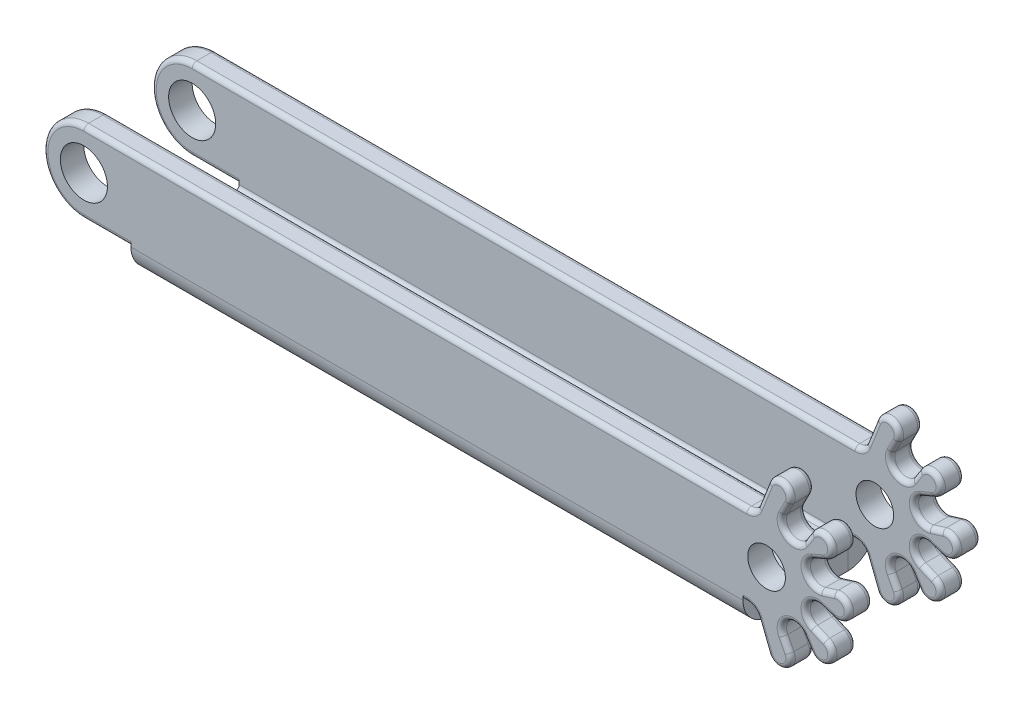
from build123d import *

# Parameters (mm, degrees)
SKETCH1_W                      = 130
SKETCH1_H                      = 28
BASE_FLANGE1_DEPTH             = 5
EDGE_FLANGE1_STRIP_W           = 21.4732
EDGE_FLANGE1_STRIP_H           = 5
EDGE_FLANGE1_STRIP_CUT_DEPTH   = 130
EDGE_FLANGE1_STRIP_2_W         = 21.4732
EDGE_FLANGE1_STRIP_2_H         = 5
EDGE_FLANGE1_STRIP_CUT_2_DEPTH = 130
EDGE_FLANGE1_DEPTH             = 130
EDGE_FLANGE1_BEND_DEPTH        = 130
SKETCH15_R                     = 5
BOSS_EXTRUDE1_DEPTH            = 5
BOSS_EXTRUDE2_DEPTH            = 5
SKETCH17_R                     = 4
CUT_EXTRUDE2_DEPTH             = 5
FILLET3_R                      = 2.5
FILLET4_R                      = 1


# Sheet-metal steps are written as plain solids
with BuildPart() as part:
    # Sketch1 → Base-Flange1 (new body)
    with BuildSketch(Plane(origin=(0, 0, 0), x_dir=(1, 0, 0), z_dir=(0, 1, 0))):
        Rectangle(SKETCH1_W, SKETCH1_H)
    extrude(amount=-BASE_FLANGE1_DEPTH)

    # Edge-Flange1 strip (across the edge) → Edge-Flange1 strip cut (cut)
    with BuildSketch(Plane(origin=(-65, 0, 14), x_dir=(0, 0, -1), z_dir=(1, 0, 0))):
        with Locations((-5, -2.5)):
            Rectangle(EDGE_FLANGE1_STRIP_W, EDGE_FLANGE1_STRIP_H)
    extrude(amount=EDGE_FLANGE1_STRIP_CUT_DEPTH, mode=Mode.SUBTRACT)

    # Edge-Flange1 strip 2 (across the edge) → Edge-Flange1 strip cut 2 (cut)
    with BuildSketch(Plane(origin=(65, 0, -14), x_dir=(0, 0, 1), z_dir=(-1, 0, 0))):
        with Locations((-5, -2.5)):
            Rectangle(EDGE_FLANGE1_STRIP_2_W, EDGE_FLANGE1_STRIP_2_H)
    extrude(amount=EDGE_FLANGE1_STRIP_CUT_2_DEPTH, mode=Mode.SUBTRACT)

    # Edge-Flange1 section (across the edge) → Edge-Flange1 (add)
    with BuildSketch(Plane(origin=(-65, 0, 14), x_dir=(0, 0, -1), z_dir=(1, 0, 0))):
        with BuildLine():
            Line((0, 0.7366), (0, 18))
            Line((0, 18), (5, 18))
            Line((5, 18), (5, 0.7366))
            ThreePointArc((5, 0.7366), (5.215745145, 0.215745145), (5.7366, 0))
            Line((5.7366, 0), (5.7366, -5))
            ThreePointArc((5.7366, -5), (1.680211239, -3.319788761), (0, 0.7366))
        make_face()
    extrude(amount=EDGE_FLANGE1_DEPTH)

    # Edge-Flange1 section 2 (across the edge) → Edge-Flange1 bend (add)
    with BuildSketch(Plane(origin=(65, 0, -14), x_dir=(0, 0, 1), z_dir=(-1, 0, 0))):
        with BuildLine():
            Line((0, 0.7366), (0, 18))
            Line((0, 18), (5, 18))
            Line((5, 18), (5, 0.7366))
            ThreePointArc((5, 0.7366), (5.215745145, 0.215745145), (5.7366, 0))
            Line((5.7366, 0), (5.7366, -5))
            ThreePointArc((5.7366, -5), (1.680211239, -3.319788761), (0, 0.7366))
        make_face()
    extrude(amount=EDGE_FLANGE1_BEND_DEPTH)

    # Sketch15 → Boss-Extrude1 (add)
    with BuildSketch(Plane.XY.offset(14)):
        with BuildLine():
            Line((-75, 18), (-65, 18))
            Line((-65, 18), (-65, 0.7366))
            Line((-65, 0.7366), (-75, 0.7366))
            ThreePointArc((-75, 0.7366), (-83.6317, 9.3683), (-75, 18))
        make_face()
        with Locations((-75, 9.3683)):
            Circle(SKETCH15_R, mode=Mode.SUBTRACT)
    boss_extrude1 = extrude(amount=-BOSS_EXTRUDE1_DEPTH)

    # Mirror3: Boss-Extrude1 across plane
    add(boss_extrude1.mirror(Plane.XY))

    # Sketch16 → Boss-Extrude2 (add)
    with BuildSketch(Plane.XY.offset(14)):
        with BuildLine():
            Line((65, 18), (67.5, 18))
            Line((67.5, 18), (70.278564416, 25.056379068))
            ThreePointArc((70.278564416, 25.056379068), (73.636399449, 26.417616992), (74.827213938, 22.995631363))
            Line((74.827213938, 22.995631363), (73.527508727, 20.472377076))
            ThreePointArc((73.527508727, 20.472377076), (74.5, 17.162528634), (77.85265847, 17.975250708))
            Line((77.85265847, 17.975250708), (79.388008177, 20.362455581))
            ThreePointArc((79.388008177, 20.362455581), (83.405777755, 20.61708317), (82.457340166, 16.704568156))
            Line((82.457340166, 16.704568156), (79.83979162, 15.607077637))
            ThreePointArc((79.83979162, 15.607077637), (78.457233587, 12.44648129), (81.547926657, 10.914015194))
            Line((81.547926657, 10.914015194), (84.258538482, 11.755816454))
            ThreePointArc((84.258538482, 11.755816454), (87.5, 9.3683), (84.258538482, 6.980783546))
            Line((84.258538482, 6.980783546), (81.547926657, 7.822584806))
            ThreePointArc((81.547926657, 7.822584806), (78.457233587, 6.29011871), (79.83979162, 3.129522363))
            Line((79.83979162, 3.129522363), (82.457340166, 2.032031844))
            ThreePointArc((82.457340166, 2.032031844), (83.405777755, -1.88048317), (79.388008177, -1.625855581))
            Line((79.388008177, -1.625855581), (77.85265847, 0.761349292))
            ThreePointArc((77.85265847, 0.761349292), (74.5, 1.574071366), (73.527508727, -1.735777076))
            Line((73.527508727, -1.735777076), (74.827213938, -4.259031363))
            ThreePointArc((74.827213938, -4.259031363), (73.636399449, -7.681016992), (70.278564416, -6.319779068))
            Line((70.278564416, -6.319779068), (67.5, 0.7366))
            Line((67.5, 0.7366), (65, 0.7366))
            Line((65, 0.7366), (65, 18))
        make_face()
    boss_extrude2 = extrude(amount=-BOSS_EXTRUDE2_DEPTH)

    # Sketch17 → Cut-Extrude2 (cut)
    with BuildSketch(Plane.XY.offset(14)):
        with Locations((70, 9.3683)):
            Circle(SKETCH17_R)
    cut_extrude2 = extrude(amount=-CUT_EXTRUDE2_DEPTH, mode=Mode.SUBTRACT)

    # Mirror5: Boss-Extrude2, Cut-Extrude2 across plane
    add(boss_extrude2.mirror(Plane.XY))
    add(cut_extrude2.mirror(Plane.XY), mode=Mode.SUBTRACT)

    # Fillet3
    fillet3_edges = [part.edges().sort_by_distance(p)[0] for p in [
        (67.5, 0.7366, 11.5),
        (67.5, 18, 11.5),
        (67.5, 18, -11.5),
        (67.5, 0.7366, -11.5),
    ]]
    fillet(fillet3_edges, radius=FILLET3_R)

    # Fillet4
    fillet4_edges = [part.edges().sort_by_distance(p)[0] for p in [
        (74.5, 1.574071366, 9),
        (74.177361333, -2.997404219, 9),
        (73.636399449, -7.681016992, 9),
        (65.39879113, 0.7366, 9),
        (69.201152463, 22.320208148, 9),
        (73.636399449, 26.417616992, 9),
        (74.177361333, 21.734004219, 9),
        (74.5, 17.162528634, 9),
        (78.620333323, 19.168853144, 9),
        (83.405777755, 20.61708317, 9),
        (81.148565893, 16.155822897, 9),
        (78.457233587, 12.44648129, 9),
        (82.90323257, 11.334915824, 9),
        (87.5, 9.3683, 9),
        (82.90323257, 7.401684176, 9),
        (78.457233587, 6.29011871, 9),
        (81.148565893, 2.580777103, 9),
        (83.405777755, -1.88048317, 9),
        (78.620333323, -0.432253144, 9),
        (74.5, 1.574071366, 14),
        (78.620333323, -0.432253144, 14),
        (83.405777755, -1.88048317, 14),
        (81.148565893, 2.580777103, 14),
        (78.457233587, 6.29011871, 14),
        (82.90323257, 7.401684176, 14),
        (87.5, 9.3683, 14),
        (82.90323257, 11.334915824, 14),
        (78.457233587, 12.44648129, 14),
        (81.148565893, 16.155822897, 14),
        (83.405777755, 20.61708317, 14),
        (78.620333323, 19.168853144, 14),
        (74.5, 17.162528634, 14),
        (74.177361333, 21.734004219, 14),
        (73.636399449, 26.417616992, 14),
        (69.201152463, 22.320208148, 14),
        (65.39879113, 0.7366, 14),
        (73.636399449, -7.681016992, 14),
        (74.177361333, -2.997404219, 14),
        (74.5, 1.574071366, -14),
        (78.620333323, -0.432253144, -14),
        (83.405777755, -1.88048317, -14),
        (81.148565893, 2.580777103, -14),
        (78.457233587, 6.29011871, -14),
        (82.90323257, 7.401684176, -14),
        (87.5, 9.3683, -14),
        (82.90323257, 11.334915824, -14),
        (78.457233587, 12.44648129, -14),
        (81.148565893, 16.155822897, -14),
        (83.405777755, 20.61708317, -14),
        (78.620333323, 19.168853144, -14),
        (74.5, 17.162528634, -14),
        (74.177361333, 21.734004219, -14),
        (73.636399449, 26.417616992, -14),
        (69.201152463, 22.320208148, -14),
        (65.39879113, 0.7366, -14),
        (73.636399449, -7.681016992, -14),
        (74.177361333, -2.997404219, -14),
        (74.5, 1.574071366, -9),
        (78.620333323, -0.432253144, -9),
        (83.405777755, -1.88048317, -9),
        (81.148565893, 2.580777103, -9),
        (78.457233587, 6.29011871, -9),
        (82.90323257, 7.401684176, -9),
        (87.5, 9.3683, -9),
        (82.90323257, 11.334915824, -9),
        (78.457233587, 12.44648129, -9),
        (81.148565893, 16.155822897, -9),
        (83.405777755, 20.61708317, -9),
        (78.620333323, 19.168853144, -9),
        (74.5, 17.162528634, -9),
        (74.177361333, 21.734004219, -9),
        (73.636399449, 26.417616992, -9),
        (69.201152463, 22.320208148, -9),
        (65.39879113, 0.7366, -9),
        (73.636399449, -7.681016992, -9),
        (74.177361333, -2.997404219, -9),
        (69.201152463, -3.583608148, -14),
        (69.201152463, -3.583608148, -9),
        (69.201152463, -3.583608148, 14),
        (69.201152463, -3.583608148, 9),
        (-4.60120887, 18, 9),
        (-4.60120887, 18, 14),
        (67.204723523, 0.302986572, -14),
        (67.204723523, 0.302986572, -9),
        (67.204723523, 0.302986572, 14),
        (67.204723523, 0.302986572, 9),
        (67.204723523, 18.433613428, -14),
        (67.204723523, 18.433613428, -9),
        (67.204723523, 18.433613428, 14),
        (67.204723523, 18.433613428, 9),
        (-4.60120887, 18, -14),
        (-4.60120887, 18, -9),
        (-70, 0.7366, 9),
        (-83.6317, 9.3683, 9),
        (-70, 0.7366, 14),
        (-83.6317, 9.3683, 14),
        (-70, 0.7366, -9),
        (-83.6317, 9.3683, -9),
        (-70, 0.7366, -14),
        (-83.6317, 9.3683, -14),
    ]]
    fillet(fillet4_edges, radius=FILLET4_R)


solid = part.part
